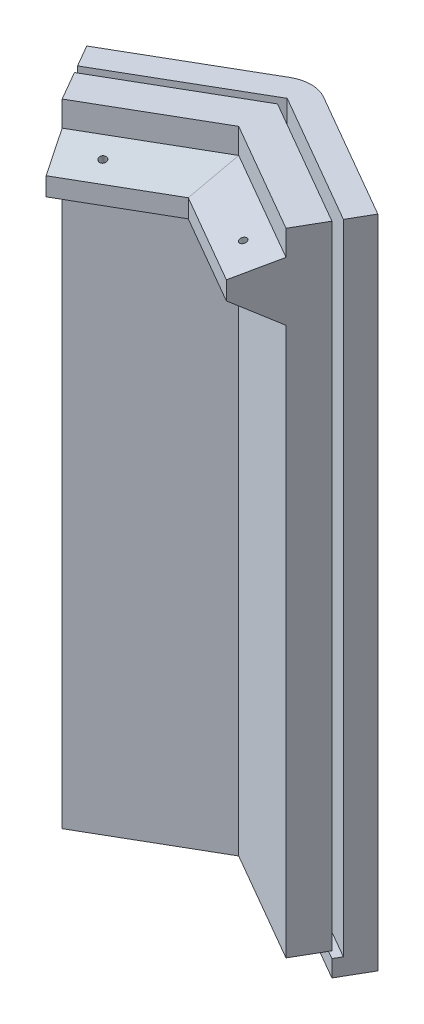
from build123d import *

# Parameters (mm, degrees)
BOSS_EXTRUDE1_DEPTH = 390
CUT_EXTRUDE2_DEPTH  = 14
CUT_EXTRUDE3_DEPTH  = 50
BOSS_EXTRUDE2_DEPTH = 10
BOSS_EXTRUDE3_REACH = 473.852
BOSS_EXTRUDE4_REACH = 479.913
SKETCH22_R          = 2.1
CUT_EXTRUDE4_DEPTH  = 15
SKETCH23_R          = 3.1
CUT_EXTRUDE5_DEPTH  = 60


with BuildPart() as part:
    # Sketch1 → Boss-Extrude1 (new body)
    with BuildSketch(Plane(origin=(0, 0, 0), x_dir=(1, 0, 0), z_dir=(0, 1, 0))):
        with BuildLine():
            Line((-10, -5.773502692), (-86.602540378, -50))
            Line((-86.602540378, -50), (-79.102540378, -62.990381057))
            Line((-79.102540378, -62.990381057), (-53.121778265, -47.990381057))
            Line((-53.121778265, -47.990381057), (-50.621778265, -52.320508076))
            Line((-50.621778265, -52.320508076), (-76.602540378, -67.320508076))
            Line((-76.602540378, -67.320508076), (-66.602540378, -84.641016151))
            Line((-66.602540378, -84.641016151), (0, -46.188021535))
            Line((0, -46.188021535), (66.602540378, -84.641016151))
            Line((66.602540378, -84.641016151), (76.602540378, -67.320508076))
            Line((76.602540378, -67.320508076), (50.621778265, -52.320508076))
            Line((50.621778265, -52.320508076), (53.121778265, -47.990381057))
            Line((53.121778265, -47.990381057), (79.102540378, -62.990381057))
            Line((79.102540378, -62.990381057), (86.602540378, -50))
            Line((86.602540378, -50), (10, -5.773502692))
            ThreePointArc((10, -5.773502692), (0, -3.094010768), (-10, -5.773502692))
        make_face()
    extrude(amount=BOSS_EXTRUDE1_DEPTH)

    # Sketch18 → Cut-Extrude2 (cut)
    with BuildSketch(Plane.XZ):
        Polygon((-76.602540378, 67.320508076), (0, 23.094010768), (76.602540378, 67.320508076), (66.602540378, 84.641016151), (0, 46.188021535), (-66.602540378, 84.641016151), align=None)
    extrude(amount=-CUT_EXTRUDE2_DEPTH, mode=Mode.SUBTRACT)

    # Sketch19 → Cut-Extrude3 (cut)
    with BuildSketch(Plane(origin=(0, 390, 0), x_dir=(1, 0, 0), z_dir=(0, 1, 0))):
        Polygon((76.602540378, -67.320508076), (0, -23.094010768), (-76.602540378, -67.320508076), (-79.102540378, -62.990381057), (0, -17.320508076), (79.102540378, -62.990381057), align=None)
    extrude(amount=-CUT_EXTRUDE3_DEPTH, mode=Mode.SUBTRACT)

    # Sketch20 → Boss-Extrude2 (add)
    with BuildSketch(Plane.XZ):
        Polygon((76.602540378, 67.320508076), (50.621778265, 52.320508076), (53.121778265, 47.990381057), (79.102540378, 62.990381057), align=None)
        Polygon((-50.621778265, 52.320508076), (-76.602540378, 67.320508076), (-79.102540378, 62.990381057), (-53.121778265, 47.990381057), align=None)
    extrude(amount=-BOSS_EXTRUDE2_DEPTH)

    # Boss-Extrude3: up to this plane
    boss_extrude3_end = Plane(origin=(-86.602540378, 390, 50), z_dir=(0.8660254037844359, 0, -0.5000000000000048))
    # Sketch21 → Boss-Extrude3 (add, up to the surface)
    with BuildSketch(Plane(origin=(0, 0, 0), x_dir=(0, 0, -1), z_dir=(1, 0, 0)), mode=Mode.PRIVATE) as boss_extrude3_sk1:
        Polygon((-46.188021535, 375), (-76.188021535, 368.206188758), (-76.188021535, 357.320508076), (-46.188021535, 340), align=None)
    boss_extrude3_tool1 = split(extrude(boss_extrude3_sk1.sketch, amount=BOSS_EXTRUDE3_REACH, dir=(-0.866025403784, 0, 0.5), mode=Mode.PRIVATE), bisect_by=boss_extrude3_end, keep=Keep.BOTH, mode=Mode.PRIVATE)
    add(boss_extrude3_tool1.solids().sort_by_distance((0, 359.670666, 58.56037))[0])

    # Boss-Extrude4: up to this plane
    boss_extrude4_end = Plane(origin=(76.602540378, 390, 67.320508076), z_dir=(-0.8660254037844398, 0, -0.49999999999999795))
    # Sketch21<2> → Boss-Extrude4 (add, up to the surface)
    with BuildSketch(Plane(origin=(0, 0, 0), x_dir=(0, 0, -1), z_dir=(1, 0, 0)), mode=Mode.PRIVATE) as boss_extrude4_sk1:
        Polygon((-46.188021535, 375), (-76.188021535, 368.206188758), (-76.188021535, 357.320508076), (-46.188021535, 340), align=None)
    boss_extrude4_tool1 = split(extrude(boss_extrude4_sk1.sketch, amount=BOSS_EXTRUDE4_REACH, dir=(0.866025403784, 0, 0.5), mode=Mode.PRIVATE), bisect_by=boss_extrude4_end, keep=Keep.BOTH, mode=Mode.PRIVATE)
    add(boss_extrude4_tool1.solids().sort_by_distance((0, 359.670666, 58.56037))[0])

    # Sketch22 → Cut-Extrude4 (cut)
    with BuildSketch(Plane(origin=(47.172106066, 360.789319124, 81.704484407), x_dir=(0.9919674102096397, -0.12336978823439819, -0.027938368473838716), z_dir=(0.12649370372465277, 0.9674695714450555, 0.21909352168866233))):
        with Locations((-89.639756751, -1.109544744)):
            Circle(SKETCH22_R)
    cut_extrude4 = extrude(amount=-CUT_EXTRUDE4_DEPTH, mode=Mode.SUBTRACT)

    # Mirror1: Cut-Extrude4 across plane
    add(cut_extrude4.mirror(Plane(origin=(0, 0, 0), x_dir=(0, 0, 1), z_dir=(1, 0, 0))), mode=Mode.SUBTRACT)

    # Sketch23 → Cut-Extrude5 (cut)
    with BuildSketch(Plane.XZ.offset(-14)):
        with Locations((-25.980762114, 49.641016151)):
            Circle(SKETCH23_R)
        with Locations((-51.961524227, 64.641016151)):
            Circle(SKETCH23_R)
    cut_extrude5 = extrude(amount=-CUT_EXTRUDE5_DEPTH, mode=Mode.SUBTRACT)

    # Mirror2: Cut-Extrude5 across plane
    add(cut_extrude5.mirror(Plane(origin=(0, 0, 0), x_dir=(0, 0, 1), z_dir=(1, 0, 0))), mode=Mode.SUBTRACT)


solid = part.part
